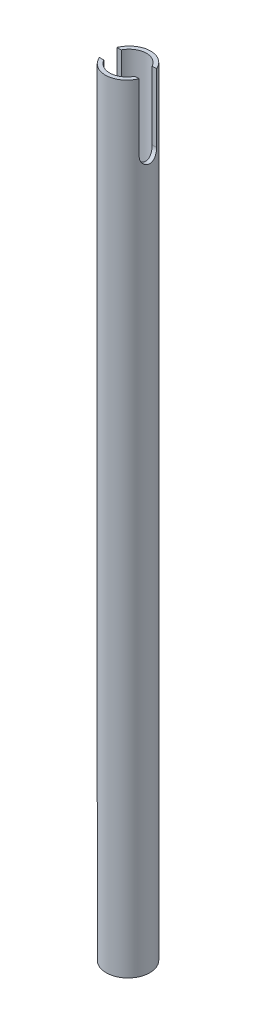
from build123d import *

# Parameters (mm, degrees)
BOSS_EXTRUDE1_OUTLINE_R   = 7.9375
BOSS_EXTRUDE1_OUTLINE_R_2 = 6.4643
BOSS_EXTRUDE1_DEPTH       = 283.742530581
BOSS_EXTRUDE1_START       = -285
BOSS_EXTRUDE1_2_OUTLINE_W = 19
BOSS_EXTRUDE1_2_OUTLINE_H = 18
BOSS_EXTRUDE1_2_DEPTH     = 1.798021877
CUT_EXTRUDE1_DEPTH        = 9.525
CUT_EXTRUDE1_DEPTH_BACK   = 9.525


with BuildPart() as part:
    # Boss-Extrude1: read off the stored shape, not the designer's step
    # Boss-Extrude1 outline → Boss-Extrude1 (new body)
    with BuildSketch(Plane(origin=(0, 0, 0), x_dir=(1, 0, 0), z_dir=(0, 1, 0))):
        Circle(BOSS_EXTRUDE1_OUTLINE_R)
        Circle(BOSS_EXTRUDE1_OUTLINE_R_2, mode=Mode.SUBTRACT)
    extrude(amount=BOSS_EXTRUDE1_DEPTH)

    # Boss-Extrude1 2 outline → Boss-Extrude1 2 (cut)
    with BuildSketch(Plane(origin=(0, 0, 0), x_dir=(0.9992080363952592, 0.039790702470935205, 0), z_dir=(0.039790702470935205, -0.9992080363952592, 0)).offset(BOSS_EXTRUDE1_START)):
        with Locations((11.5, 0)):
            Rectangle(BOSS_EXTRUDE1_2_OUTLINE_W, BOSS_EXTRUDE1_2_OUTLINE_H)
    extrude(amount=BOSS_EXTRUDE1_2_DEPTH, mode=Mode.SUBTRACT)

    # Sketch2 → Cut-Extrude1 (cut, two sides: drawn at the far end of the back side and taken through both)
    with BuildSketch(Plane(origin=(0, 0, 0), x_dir=(0, 0, -1), z_dir=(1, 0, 0)).offset(-CUT_EXTRUDE1_DEPTH_BACK)):
        with BuildLine():
            Line((3.175, 284.215449167), (3.175, 258.815449167))
            ThreePointArc((3.175, 258.815449167), (0, 255.640449167), (-3.175, 258.815449167))
            Line((-3.175, 258.815449167), (-3.175, 284.215449167))
            Line((-3.175, 284.215449167), (3.175, 284.215449167))
        make_face()
    extrude(amount=CUT_EXTRUDE1_DEPTH + CUT_EXTRUDE1_DEPTH_BACK, mode=Mode.SUBTRACT)


solid = part.part
